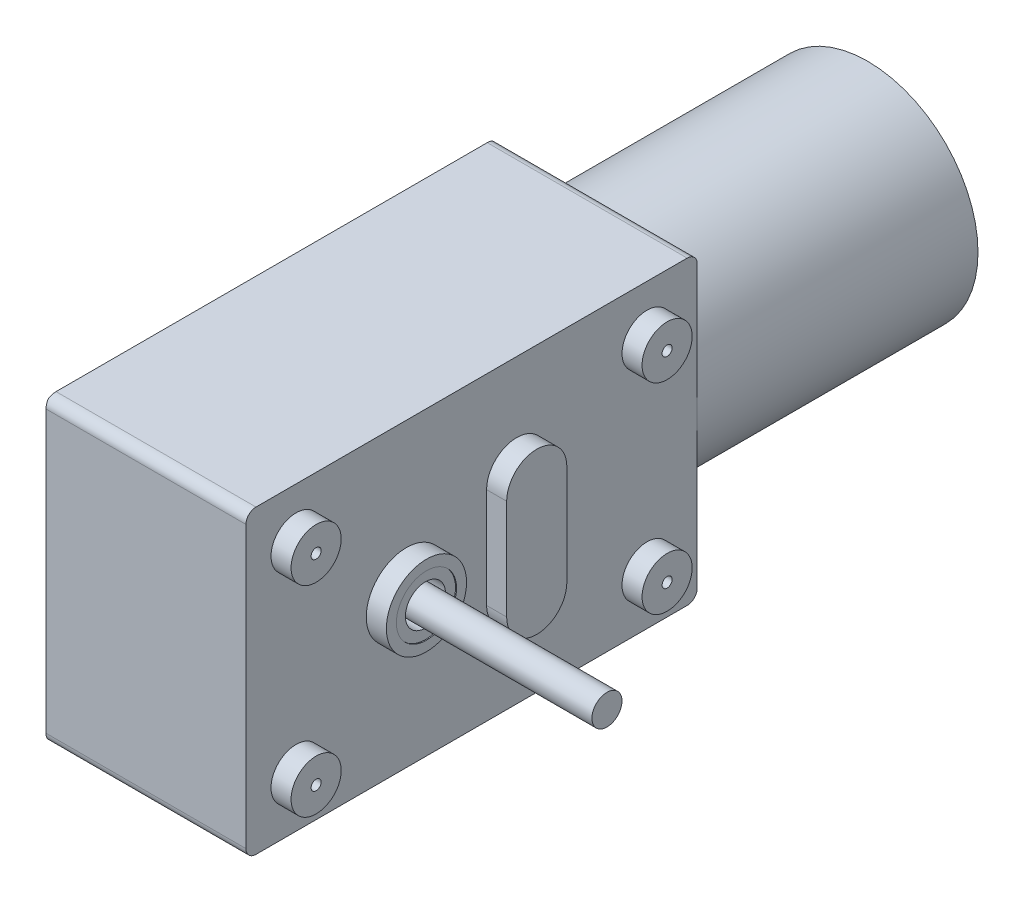
from build123d import *

# Parameters (mm, degrees)
SKETCH1_W           = 45
SKETCH1_H           = 30
BOSS_EXTRUDE1_DEPTH = 21
SKETCH2_R           = 2.5
SKETCH2_R_2         = 0.5
SKETCH2_R_3         = 4
SKETCH2_R_4         = 3
BOSS_EXTRUDE2_DEPTH = 2
SKETCH3_R           = 3
SKETCH3_R_2         = 2
BOSS_EXTRUDE3_DEPTH = 1.9
SKETCH4_R           = 1.5
BOSS_EXTRUDE4_DEPTH = 20
BOSS_EXTRUDE5_DEPTH = 2
CHAMFER1_SIZE       = 5
CHAMFER1_SIZE2      = 1.062782808
SKETCH7_R           = 5
BOSS_EXTRUDE6_DEPTH = 0.8
FILLET2_R           = 16
SKETCH8_R           = 11
BOSS_EXTRUDE7_DEPTH = 28
SKETCH9_R           = 10.8
CUT_EXTRUDE1_DEPTH  = 1
SKETCH10_R          = 2
BOSS_EXTRUDE8_DEPTH = 1
FILLET3_R           = 0.5
FILLET4_R           = 1


with BuildPart() as part:
    # Sketch1 → Boss-Extrude1 (new body)
    with BuildSketch(Plane(origin=(0, 0, 0), x_dir=(0, 0, -1), z_dir=(1, 0, 0))):
        with Locations((22.5, 15)):
            Rectangle(SKETCH1_W, SKETCH1_H)
    extrude(amount=-BOSS_EXTRUDE1_DEPTH)

    # Sketch2 → Boss-Extrude2 (add)
    # profile 1 of 5: a face of its own
    with BuildSketch(Plane(origin=(0, 0, 0), x_dir=(0, 0, -1), z_dir=(1, 0, 0))):
        with Locations((5, 25)):
            Circle(SKETCH2_R)
        with Locations((5, 25)):
            Circle(SKETCH2_R_2, mode=Mode.SUBTRACT)
    # profile 2 of 5: a face of its own
    with BuildSketch(Plane(origin=(0, 0, 0), x_dir=(0, 0, -1), z_dir=(1, 0, 0))):
        with Locations((5, 5)):
            Circle(SKETCH2_R)
        with Locations((5, 5)):
            Circle(SKETCH2_R_2, mode=Mode.SUBTRACT)
    # profile 3 of 5: a face of its own
    with BuildSketch(Plane(origin=(0, 0, 0), x_dir=(0, 0, -1), z_dir=(1, 0, 0))):
        with Locations((40, 5)):
            Circle(SKETCH2_R)
        with Locations((40, 5)):
            Circle(SKETCH2_R_2, mode=Mode.SUBTRACT)
    # profile 4 of 5: a face of its own
    with BuildSketch(Plane(origin=(0, 0, 0), x_dir=(0, 0, -1), z_dir=(1, 0, 0))):
        with Locations((40, 25)):
            Circle(SKETCH2_R)
        with Locations((40, 25)):
            Circle(SKETCH2_R_2, mode=Mode.SUBTRACT)
    # profile 5 of 5: a face of its own
    with BuildSketch(Plane(origin=(0, 0, 0), x_dir=(0, 0, -1), z_dir=(1, 0, 0))):
        with Locations((16, 15)):
            Circle(SKETCH2_R_3)
        with Locations((16, 15)):
            Circle(SKETCH2_R_4, mode=Mode.SUBTRACT)
    extrude(amount=BOSS_EXTRUDE2_DEPTH)



with BuildPart() as body_2:
    # Sketch3 → Boss-Extrude3 (new body)
    with BuildSketch(Plane(origin=(0, 0, 0), x_dir=(0, 0, -1), z_dir=(1, 0, 0))):
        with Locations((16, 15)):
            Circle(SKETCH3_R)
        with Locations(Location((16, 15, 0), (0, 0, 180))):
            Circle(SKETCH3_R_2, mode=Mode.SUBTRACT)
    extrude(amount=BOSS_EXTRUDE3_DEPTH)


with BuildPart() as part_1:
    add(part.part)

    add(body_2.part)  # Boss-Extrude4 merges body 2
    # Sketch4 → Boss-Extrude4 (add)
    with BuildSketch(Plane(origin=(0, 0, 0), x_dir=(0, 0, -1), z_dir=(1, 0, 0))):
        with Locations((16, 15)):
            Circle(SKETCH4_R)
    extrude(amount=BOSS_EXTRUDE4_DEPTH)

    # Sketch6 → Boss-Extrude5 (add)
    with BuildSketch(Plane(origin=(0, 0, 0), x_dir=(0, 0, -1), z_dir=(1, 0, 0))):
        with BuildLine():
            Line((30, 20), (30, 10))
            ThreePointArc((30, 10), (27, 7), (24, 10))
            Line((24, 10), (24, 20))
            ThreePointArc((24, 20), (27, 23), (30, 20))
        make_face()
    extrude(amount=BOSS_EXTRUDE5_DEPTH)

    # Chamfer1
    chamfer1_edges = [part_1.edges().sort_by_distance(p)[0] for p in [
        (-21, 30, -22.5),
        (-21, 15, 0),
        (-21, 0, -22.5),
    ]]
    chamfer1_side = [part_1.faces().sort_by_distance(p)[0] for p in [
        (-21, 15, -22.5),
    ]]
    chamfer(chamfer1_edges, length=CHAMFER1_SIZE, length2=CHAMFER1_SIZE2, reference=chamfer1_side[0])

    # Sketch7 → Boss-Extrude6 (add)
    with BuildSketch(Plane.ZY.offset(21)):
        with Locations(Location((-15, 15, 0), (0, 0, 180))):
            Circle(SKETCH7_R)
    extrude(amount=BOSS_EXTRUDE6_DEPTH)

    # Fillet2
    # the kernel refuses this fillet: 16 mm, written as the material it takes off along each edge
    with BuildSketch(Plane(origin=(-21.8, 15, -15), x_dir=(0, 0, -1), z_dir=(0, 1, 0))) as fillet2_piece_1:
        with BuildLine():
            CenterArc((0.004001601, -16), FILLET2_R, 71.805127661, 18.194872339)
            Line((0.004001601, 0), (0.004001601, 0.32))
            Line((0.004001601, 0.32), (5, 0.32))
            Line((5, 0.32), (5.32, 0))
            ThreePointArc((5.32, 0), (5.32, -0.4), (5.099919968, -0.496))
            Line((5.099919968, -0.496), (5, -0.8))
        make_face()
    revolve(axis=Axis((-21.8, 15, -15), (-1, 0, 0)), mode=Mode.SUBTRACT)

    # Fillet4
    fillet4_edges = [part_1.edges().sort_by_distance(p)[0] for p in [
        (-9.968608596, 30, -45),
        (-9.968608596, 30, 0),
        (-9.968608596, 0, -45),
        (-9.968608596, 0, 0),
    ]]
    fillet(fillet4_edges, radius=FILLET4_R)


with BuildPart() as body_2_2:
    # Sketch8 → Boss-Extrude7 (new body)
    with BuildSketch(Plane(origin=(0, 0, -45), x_dir=(-1, 0, 0), z_dir=(0, 0, -1))):
        with Locations(Location((11, 16, 0), (0, 0, 270))):
            Circle(SKETCH8_R)
    extrude(amount=BOSS_EXTRUDE7_DEPTH)

    # Sketch9 → Cut-Extrude1 (cut)
    with BuildSketch(Plane(origin=(0, 0, -73), x_dir=(-1, 0, 0), z_dir=(0, 0, -1))):
        with Locations(Location((11, 16, 0), (0, 0, 90))):
            Circle(SKETCH9_R)
    extrude(amount=-CUT_EXTRUDE1_DEPTH, mode=Mode.SUBTRACT)

    # Sketch10 → Boss-Extrude8 (add)
    with BuildSketch(Plane(origin=(0, 0, -72), x_dir=(-1, 0, 0), z_dir=(0, 0, -1))):
        with Locations(Location((11, 16, 0), (0, 0, 90))):
            Circle(SKETCH10_R)
    extrude(amount=BOSS_EXTRUDE8_DEPTH)

    # Fillet3
    fillet3_edges = [body_2_2.edges().sort_by_distance(p)[0] for p in [
        (-11, 14, -73),
    ]]
    fillet(fillet3_edges, radius=FILLET3_R)


solid = Compound([part_1.part, body_2_2.part])
